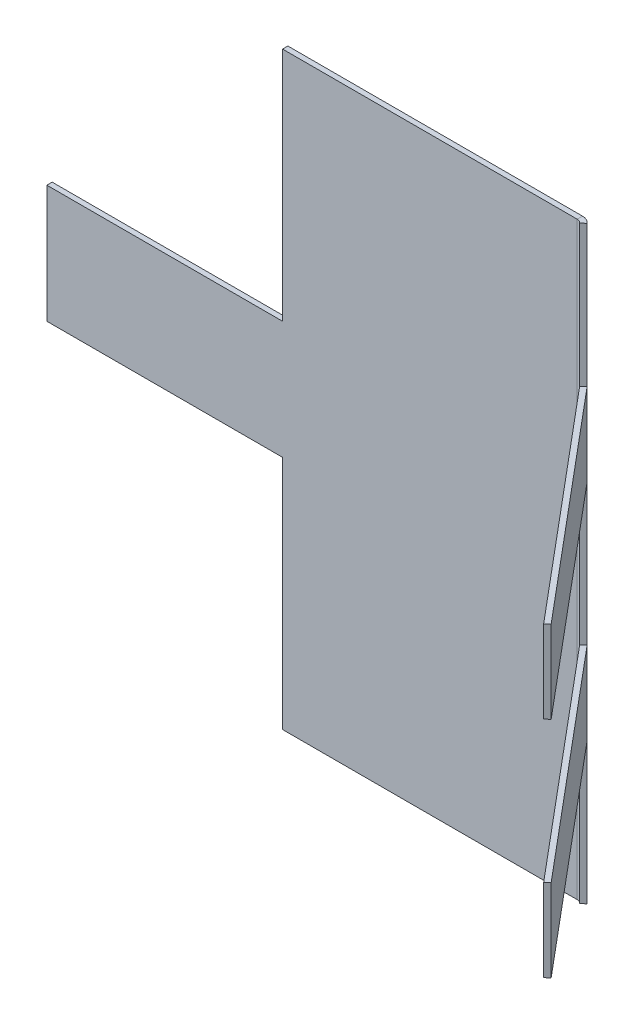
from build123d import *

# Parameters (mm, degrees)
SKETCH2_W          = 50
SKETCH2_H          = 100
BASE_FLANGE1_DEPTH = 0.9
EDGE_FLANGE1_DEPTH = 100
SKETCH10_W         = 49.533692342
SKETCH10_H         = 24
CUT_EXTRUDE1_DEPTH = 10
SKETCH12_W         = 49.533692342
SKETCH12_H         = 24
CUT_EXTRUDE2_DEPTH = 10
SKETCH13_W         = 49.533692342
SKETCH13_H         = 24
CUT_EXTRUDE3_DEPTH = 10
SKETCH17_W         = 80
SKETCH17_H         = 20
TAB4_DEPTH         = 0.9


# Sheet-metal steps are written as plain solids
with BuildPart() as part:
    # Sketch2 → Base-Flange1 (new body)
    with BuildSketch(Plane.XY):
        Rectangle(SKETCH2_W, SKETCH2_H)
    extrude(amount=-BASE_FLANGE1_DEPTH)

    # Edge-Flange1 section (across the edge) → Edge-Flange1 (add)
    with BuildSketch(Plane(origin=(25.466307658, -50, 0), x_dir=(-0.7660444431189747, 0, 0.6427876096865435), z_dir=(0, 1, 0))):
        with BuildLine():
            Line((-0.9, 0.466307658), (-0.9, 50))
            Line((-0.9, 50), (0, 50))
            Line((0, 50), (0, 0.466307658))
            ThreePointArc((0, 0.466307658), (0.093692213, 0.043689396), (0.35721239, -0.299736785))
            Line((0.35721239, -0.299736785), (-0.221296458, -0.989176784))
            ThreePointArc((-0.221296458, -0.989176784), (-0.721984795, -0.336667039), (-0.9, 0.466307658))
        make_face()
    extrude(amount=EDGE_FLANGE1_DEPTH)

    # Sketch10 → Cut-Extrude1 (cut)
    with BuildSketch(Plane(origin=(14.944242787, 0, -12.539708611), x_dir=(0.6427876096865437, 0, 0.7660444431189746), z_dir=(-0.7660444431189746, 0, 0.6427876096865437))):
        with Locations((41.602580856, 38)):
            Rectangle(SKETCH10_W, SKETCH10_H)
    extrude(amount=-CUT_EXTRUDE1_DEPTH, mode=Mode.SUBTRACT)

    # Sketch12 → Cut-Extrude2 (cut)
    with BuildSketch(Plane(origin=(14.944242787, 0, -12.539708611), x_dir=(0.6427876096865437, 0, 0.7660444431189746), z_dir=(-0.7660444431189746, 0, 0.6427876096865437))):
        with Locations((41.602580856, 0)):
            Rectangle(SKETCH12_W, SKETCH12_H)
    extrude(amount=-CUT_EXTRUDE2_DEPTH, mode=Mode.SUBTRACT)

    # Sketch13 → Cut-Extrude3 (cut)
    with BuildSketch(Plane(origin=(14.944242787, 0, -12.539708611), x_dir=(0.6427876096865437, 0, 0.7660444431189746), z_dir=(-0.7660444431189746, 0, 0.6427876096865437))):
        with Locations((41.602580856, -38)):
            Rectangle(SKETCH13_W, SKETCH13_H)
    extrude(amount=-CUT_EXTRUDE3_DEPTH, mode=Mode.SUBTRACT)

    # Sketch17 → Tab4 (add)
    with BuildSketch(Plane.XY):
        with Locations((-25, 0)):
            Rectangle(SKETCH17_W, SKETCH17_H)
    extrude(amount=-TAB4_DEPTH)


solid = part.part
